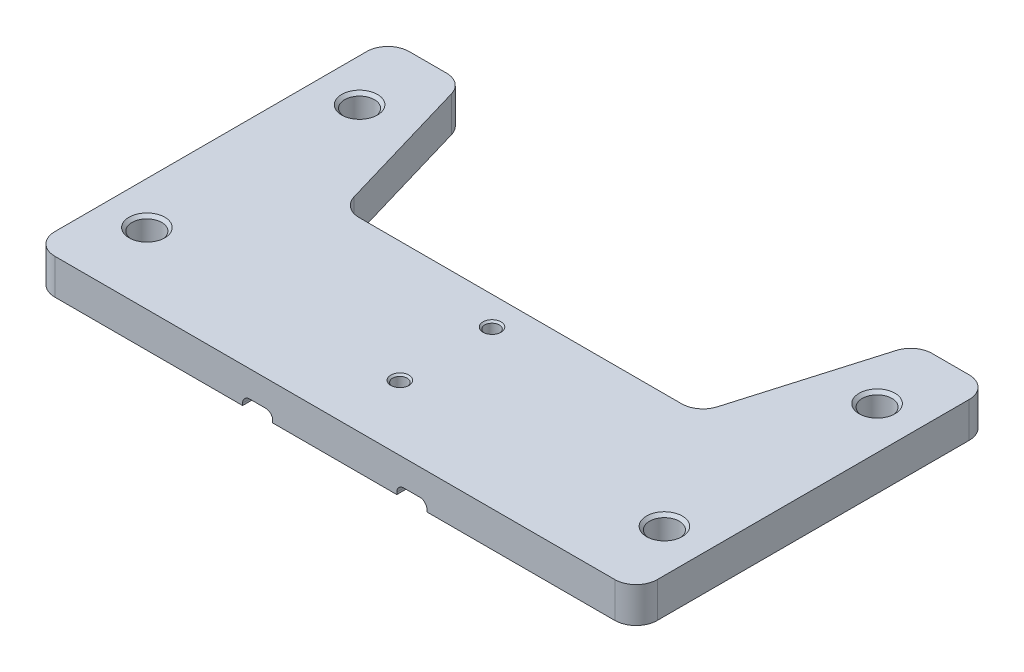
from build123d import *

# Parameters (mm, degrees)
BOSS_EXTRUDE1_DEPTH                = 5
M2_5X0_45_TAPPED_HOLE1_D           = 2.05
M2_5X0_45_TAPPED_HOLE1_DEPTH       = 6.35
M2_5X0_45_TAPPED_HOLE1_CSINK_D     = 2.55
M2_5X0_45_TAPPED_HOLE1_CSINK_ANGLE = 90
M2_5X0_45_TAPPED_HOLE1_TIP         = 0.615882135
M5X0_8_TAPPED_HOLE1_D              = 4.2
M5X0_8_TAPPED_HOLE1_DEPTH          = 12.4
M5X0_8_TAPPED_HOLE1_CSINK_D        = 5.05
M5X0_8_TAPPED_HOLE1_CSINK_ANGLE    = 90
M5X0_8_TAPPED_HOLE1_TIP            = 1.2618073
CUT_EXTRUDE2_DEPTH                 = 51.168392834
CUT_EXTRUDE2_DEPTH_BACK            = 51.168392834
SKETCH8_W                          = 4.25
SKETCH8_H                          = 1.3
CUT_EXTRUDE3_DEPTH                 = 66.812232905
FILLET1_R                          = 3
FILLET2_R                          = 1


with BuildPart() as part:
    # Sketch2 → Boss-Extrude1 (new body)
    with BuildSketch(Plane(origin=(0, 0, 0), x_dir=(1, 0, 0), z_dir=(0, 1, 0))):
        Polygon((42.5, 0), (42.5, 50), (22.5, 50), (8.75, 26.184301396), (-8.75, 26.184301396), (-22.5, 50), (-42.5, 50), (-42.5, 0), align=None)
    extrude(amount=BOSS_EXTRUDE1_DEPTH)

    # M2.5x0.45 Tapped Hole1
    with Locations(Plane(origin=(0, 5, 0), x_dir=(1, 0, 0), z_dir=(0, 1, 0))):
        with Locations((0, 9.184301396), (0, 22.184301396)):
            CounterSinkHole(M2_5X0_45_TAPPED_HOLE1_D / 2, M2_5X0_45_TAPPED_HOLE1_CSINK_D / 2, depth=M2_5X0_45_TAPPED_HOLE1_DEPTH, counter_sink_angle=M2_5X0_45_TAPPED_HOLE1_CSINK_ANGLE)
            with Locations((0, 0, -(M2_5X0_45_TAPPED_HOLE1_DEPTH + M2_5X0_45_TAPPED_HOLE1_TIP / 2))):  # 118° drill point
                Cone(0, M2_5X0_45_TAPPED_HOLE1_D / 2, M2_5X0_45_TAPPED_HOLE1_TIP, mode=Mode.SUBTRACT)

    # M5x0.8 Tapped Hole1
    with Locations(Plane(origin=(0, 5, 0), x_dir=(1, 0, 0), z_dir=(0, 1, 0))):
        with Locations((-36.5, 40), (36.5, 40), (-36.5, 10), (36.5, 10)):
            CounterSinkHole(M5X0_8_TAPPED_HOLE1_D / 2, M5X0_8_TAPPED_HOLE1_CSINK_D / 2, depth=M5X0_8_TAPPED_HOLE1_DEPTH, counter_sink_angle=M5X0_8_TAPPED_HOLE1_CSINK_ANGLE)
            with Locations((0, 0, -(M5X0_8_TAPPED_HOLE1_DEPTH + M5X0_8_TAPPED_HOLE1_TIP / 2))):  # 118° drill point
                Cone(0, M5X0_8_TAPPED_HOLE1_D / 2, M5X0_8_TAPPED_HOLE1_TIP, mode=Mode.SUBTRACT)

    # Sketch8 → Cut-Extrude2 (cut, two sides: drawn at the far end of the back side and taken through both)
    with BuildSketch(Plane(origin=(0, 0, -26.184301396), x_dir=(-1, 0, 0), z_dir=(0, 0, -1)).offset(-CUT_EXTRUDE2_DEPTH_BACK)):
        with Locations((-10.875, 0.65)):
            Rectangle(SKETCH8_W, SKETCH8_H)
        with Locations((10.875, 0.65)):
            Rectangle(SKETCH8_W, SKETCH8_H)
    extrude(amount=CUT_EXTRUDE2_DEPTH + CUT_EXTRUDE2_DEPTH_BACK, mode=Mode.SUBTRACT)

    # Sketch9 → Cut-Extrude3 (cut, through all)
    with BuildSketch(Plane.XZ):
        Polygon((-32, -50), (-25, -26.184301396), (25, -26.184301396), (32, -50), align=None)
    extrude(amount=-CUT_EXTRUDE3_DEPTH, mode=Mode.SUBTRACT)

    # Fillet1
    fillet1_edges = [part.edges().sort_by_distance(p)[0] for p in [
        (42.5, 2.5, -50),
        (-42.5, 2.5, -50),
        (-32, 2.5, -50),
        (32, 2.5, -50),
        (25, 2.5, -26.184301396),
        (-25, 2.5, -26.184301396),
        (42.5, 2.5, 0),
        (-42.5, 2.5, 0),
    ]]
    fillet(fillet1_edges, radius=FILLET1_R)

    # Fillet2
    fillet2_edges = [part.edges().sort_by_distance(p)[0] for p in [
        (-13, 1.3, -13.092150698),
        (-8.75, 1.3, -13.092150698),
        (8.75, 1.3, -13.092150698),
        (13, 1.3, -13.092150698),
    ]]
    fillet(fillet2_edges, radius=FILLET2_R)


solid = part.part
